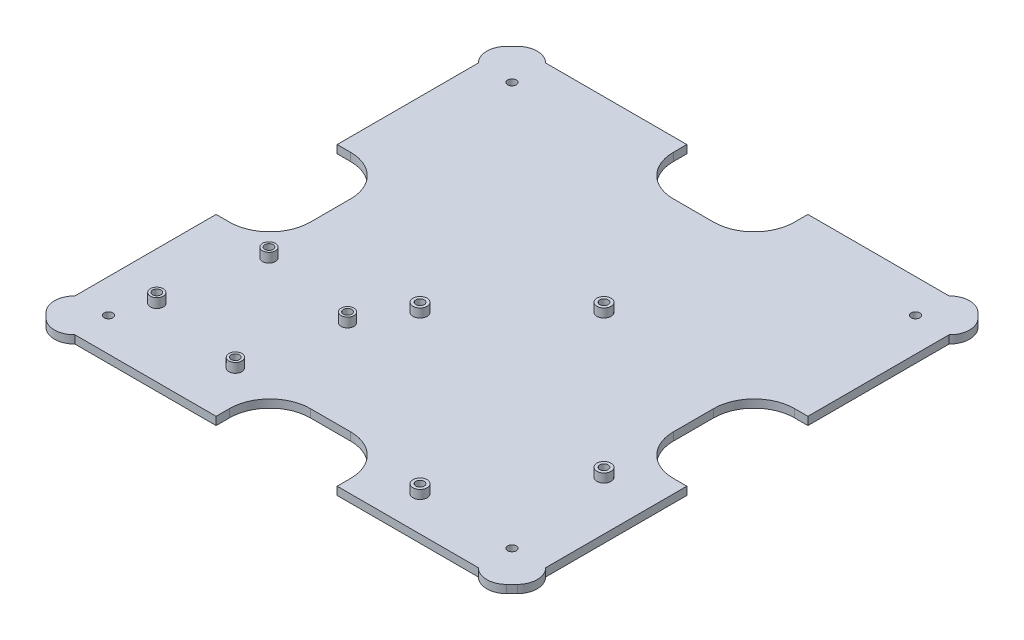
from build123d import *

# Parameters (mm, degrees)
SHELL_BOSS_DEPTH             = 3
SHELL_FILET_R                = 7.5
SHELL_PILLAR_HOLE_DEPTH      = 127.973590966
SHELL_PILLAR_HOLE_DEPTH_BACK = 127.973590966
SKETCH5_R                    = 1.6
SKETCH16_R                   = 2.625
ARDUINO_MOUNT_BOSS_DEPTH     = 3.25
SKETCH22_R                   = 1.55
ARDUINO_CUT_DEPTH            = 6.25
SKETCH20_R                   = 2.4
BOSS_EXTRUDE9_DEPTH          = 3.5
SKETCH37_R                   = 1.55
CUT_EXTRUDE4_DEPTH           = 6.5
CUT_EXTRUDE5_DEPTH           = 128.104456266
CUT_EXTRUDE5_DEPTH_BACK      = 128.104456266
SKETCH38_W                   = 45
SKETCH38_H                   = 20
SKETCH38_W_2                 = 20
SKETCH38_H_2                 = 45
FILLET1_R                    = 15


with BuildPart() as part:
    # Sketch1 → shell-boss (new body)
    with BuildSketch(Plane(origin=(0, 0, 0), x_dir=(1, 0, 0), z_dir=(0, 1, 0))):
        with BuildLine():
            Line((87.5, 75), (96.856853139, 75))
            ThreePointArc((96.856853139, 75), (86.620580695, 86.620580695), (75, 96.856853139))
            Line((75, 96.856853139), (75, 87.5))
            Line((75, 87.5), (-75, 87.5))
            Line((-75, 87.5), (-75, 96.856853139))
            ThreePointArc((-75, 96.856853139), (-86.620580695, 86.620580695), (-96.856853139, 75))
            Line((-96.856853139, 75), (-87.5, 75))
            Line((-87.5, 75), (-87.5, -75))
            Line((-87.5, -75), (-96.856853139, -75))
            ThreePointArc((-96.856853139, -75), (-86.620580695, -86.620580695), (-75, -96.856853139))
            Line((-75, -96.856853139), (-75, -87.5))
            Line((-75, -87.5), (75, -87.5))
            Line((75, -87.5), (75, -96.856853139))
            ThreePointArc((75, -96.856853139), (86.620580695, -86.620580695), (96.856853139, -75))
            Line((96.856853139, -75), (87.5, -75))
            Line((87.5, -75), (87.5, 75))
        make_face()
    extrude(amount=SHELL_BOSS_DEPTH)

    # shell-filet
    # the kernel refuses this fillet: 7.5 mm, written as the material it takes off along each edge
    with BuildSketch(Plane(origin=(-96.856853139, -35.154925645, 75), x_dir=(1, 0, 0), z_dir=(0, 1, 0)), Plane(origin=(-75, -35.154925645, -96.856853139), x_dir=(0, 0, 1), z_dir=(0, 1, 0)), Plane(origin=(96.856853139, -35.154925645, -75), x_dir=(-1, 0, 0), z_dir=(0, 1, 0))) as shell_filet_piece_1:
        with BuildLine():
            CenterArc((14.59802961, -5.364705882), SHELL_FILET_R, 134.332691644, 90)
            Line((9.233323727, -10.605882353), (9.12602961, -10.710705882))
            ThreePointArc((9.12602961, -10.710705882), (4.351219382, -5.53403146), (-0.118600228, -0.091836735))
            Line((-0.118600228, -0.091836735), (0, 0.15))
            ThreePointArc((0, 0.15), (4.67842657, 0.15), (9.25202961, 0.107294118))
            Line((9.25202961, 0.107294118), (9.356853139, 0))
        make_face()
    extrude(amount=73.30985129, mode=Mode.SUBTRACT)
    with BuildSketch(Plane(origin=(-96.856853139, -35.154925645, -75), x_dir=(0.656616644600313, 0, -0.7542244904760296), z_dir=(0, 1, 0)), Plane(origin=(75, -35.154925645, -96.856853139), x_dir=(0.7542244904760282, 0, 0.6566166446003142), z_dir=(0, 1, 0)), Plane(origin=(96.856853139, -35.154925645, 75), x_dir=(-0.656616644600296, 0, 0.7542244904760443), z_dir=(0, 1, 0)), Plane(origin=(-75, -35.154925645, 96.856853139), x_dir=(-0.7542244904760502, 0, -0.6566166446002892), z_dir=(0, 1, 0))) as shell_filet_piece_2:
        with BuildLine():
            CenterArc((13.631501781, -7.487636269), SHELL_FILET_R, 86.709654831, 90)
            Line((6.143865512, -7.057167791), (5.994112787, -7.048558422))
            ThreePointArc((5.994112787, -7.048558422), (2.958799083, -3.627076392), (-0.113133674, -0.098492497))
            Line((-0.113133674, -0.098492497), (-0.00860937, 0.149752725))
            ThreePointArc((-0.00860937, 0.149752725), (7.030985129, 0.351940947), (14.070579628, 0.149752725))
            Line((14.070579628, 0.149752725), (14.061970258, 0))
        make_face()
    extrude(amount=73.30985129, mode=Mode.SUBTRACT)
    with BuildSketch(Plane(origin=(75, -35.154925645, 96.856853139), x_dir=(0.754224490476002, 0, -0.6566166446003444), z_dir=(0, 1, 0))) as shell_filet_piece_3:
        with BuildLine():
            CenterArc((13.631501781, 7.487636269), SHELL_FILET_R, 183.290345169, 90)
            Line((6.143865512, 7.057167791), (5.994112787, 7.048558422))
            ThreePointArc((5.994112787, 7.048558422), (2.958799083, 3.627076392), (-0.113133674, 0.098492497))
            Line((-0.113133674, 0.098492497), (-0.00860937, -0.149752725))
            ThreePointArc((-0.00860937, -0.149752725), (7.030985129, -0.351940947), (14.070579628, -0.149752725))
            Line((14.070579628, -0.149752725), (14.061970258, 0))
        make_face()
    extrude(amount=73.30985129, mode=Mode.SUBTRACT)

    # Sketch5 → shell-pillar-hole (cut, two sides: drawn at the far end of the back side and taken through both)
    with BuildSketch(Plane(origin=(0, 3, 0), x_dir=(1, 0, 0), z_dir=(0, 1, 0)).offset(-SHELL_PILLAR_HOLE_DEPTH_BACK)):
        with Locations(Location((75, -75, 0), (0, 0, 270))):
            Circle(SKETCH5_R)
        with Locations(Location((-75, -75, 0), (0, 0, 270))):
            Circle(SKETCH5_R)
        with Locations(Location((75, 75, 0), (0, 0, 270))):
            Circle(SKETCH5_R)
        with Locations(Location((-75, 75, 0), (0, 0, 270))):
            Circle(SKETCH5_R)
    extrude(amount=SHELL_PILLAR_HOLE_DEPTH + SHELL_PILLAR_HOLE_DEPTH_BACK, mode=Mode.SUBTRACT)

    # Sketch16 → arduino-mount-boss (add)
    with BuildSketch(Plane(origin=(0, 3, 0), x_dir=(1, 0, 0), z_dir=(0, 1, 0))):
        with Locations(Location((16.113832172, 18.065022624, 0), (0, 0, 90))):
            Circle(SKETCH16_R)
        with Locations(Location((-18.065022624, -16.113832172, 0), (0, 0, 90))):
            Circle(SKETCH16_R)
        with Locations(Location((69.241027385, -35.062172588, 0), (0, 0, 90))):
            Circle(SKETCH16_R)
        with Locations(Location((40.360523699, -74.539378496, 0), (0, 0, 90))):
            Circle(SKETCH16_R)
    extrude(amount=ARDUINO_MOUNT_BOSS_DEPTH)

    # Sketch22 → arduino-cut (cut)
    with BuildSketch(Plane(origin=(0, 6.25, 0), x_dir=(1, 0, 0), z_dir=(0, 1, 0))):
        with Locations(Location((16.113832172, 18.065022624, 0), (0, 0, 270))):
            Circle(SKETCH22_R)
        with Locations(Location((-18.065022624, -16.113832172, 0), (0, 0, 270))):
            Circle(SKETCH22_R)
        with Locations(Location((69.241027385, -35.062172588, 0), (0, 0, 270))):
            Circle(SKETCH22_R)
        with Locations(Location((40.360523699, -74.539378496, 0), (0, 0, 270))):
            Circle(SKETCH22_R)
    extrude(amount=-ARDUINO_CUT_DEPTH, mode=Mode.SUBTRACT)

    # Sketch20 → Boss-Extrude9 (add)
    with BuildSketch(Plane(origin=(0, 3, 0), x_dir=(1, 0, 0), z_dir=(0, 1, 0))):
        with Locations(Location((-63.655367651, -26.687870454, 0), (0, 0, 270))):
            Circle(SKETCH20_R)
        with Locations(Location((-28.202288543, -32.93920485, 0), (0, 0, 270))):
            Circle(SKETCH20_R)
        with Locations(Location((-34.453622939, -68.392283958, 0), (0, 0, 270))):
            Circle(SKETCH20_R)
        with Locations(Location((-69.906702047, -62.140949562, 0), (0, 0, 270))):
            Circle(SKETCH20_R)
    extrude(amount=BOSS_EXTRUDE9_DEPTH)

    # Sketch37 → Cut-Extrude4 (cut)
    with BuildSketch(Plane(origin=(0, 6.5, 0), x_dir=(1, 0, 0), z_dir=(0, 1, 0))):
        with Locations(Location((-63.655367651, -26.687870454, 0), (0, 0, 270))):
            Circle(SKETCH37_R)
        with Locations(Location((-28.202288543, -32.93920485, 0), (0, 0, 270))):
            Circle(SKETCH37_R)
        with Locations(Location((-69.906702047, -62.140949562, 0), (0, 0, 270))):
            Circle(SKETCH37_R)
        with Locations(Location((-34.453622939, -68.392283958, 0), (0, 0, 270))):
            Circle(SKETCH37_R)
    extrude(amount=-CUT_EXTRUDE4_DEPTH, mode=Mode.SUBTRACT)

    # Sketch38 → Cut-Extrude5 (cut, two sides: drawn at the far end of the back side and taken through both)
    with BuildSketch(Plane.XZ.offset(-CUT_EXTRUDE5_DEPTH_BACK)):
        with Locations((0, 77.5)):
            Rectangle(SKETCH38_W, SKETCH38_H)
        with Locations((77.5, 0)):
            Rectangle(SKETCH38_W_2, SKETCH38_H_2)
        with Locations((0, -77.5)):
            Rectangle(SKETCH38_W, SKETCH38_H)
        with Locations((-77.5, 0)):
            Rectangle(SKETCH38_W_2, SKETCH38_H_2)
    extrude(amount=CUT_EXTRUDE5_DEPTH + CUT_EXTRUDE5_DEPTH_BACK, mode=Mode.SUBTRACT)

    # Fillet1
    fillet1_edges = [part.edges().sort_by_distance(p)[0] for p in [
        (22.5, 1.5, 67.5),
        (-22.5, 1.5, 67.5),
        (67.5, 1.5, -22.5),
        (67.5, 1.5, 22.5),
        (-22.5, 1.5, -67.5),
        (22.5, 1.5, -67.5),
        (-67.5, 1.5, 22.5),
        (-67.5, 1.5, -22.5),
    ]]
    fillet(fillet1_edges, radius=FILLET1_R)


solid = part.part
